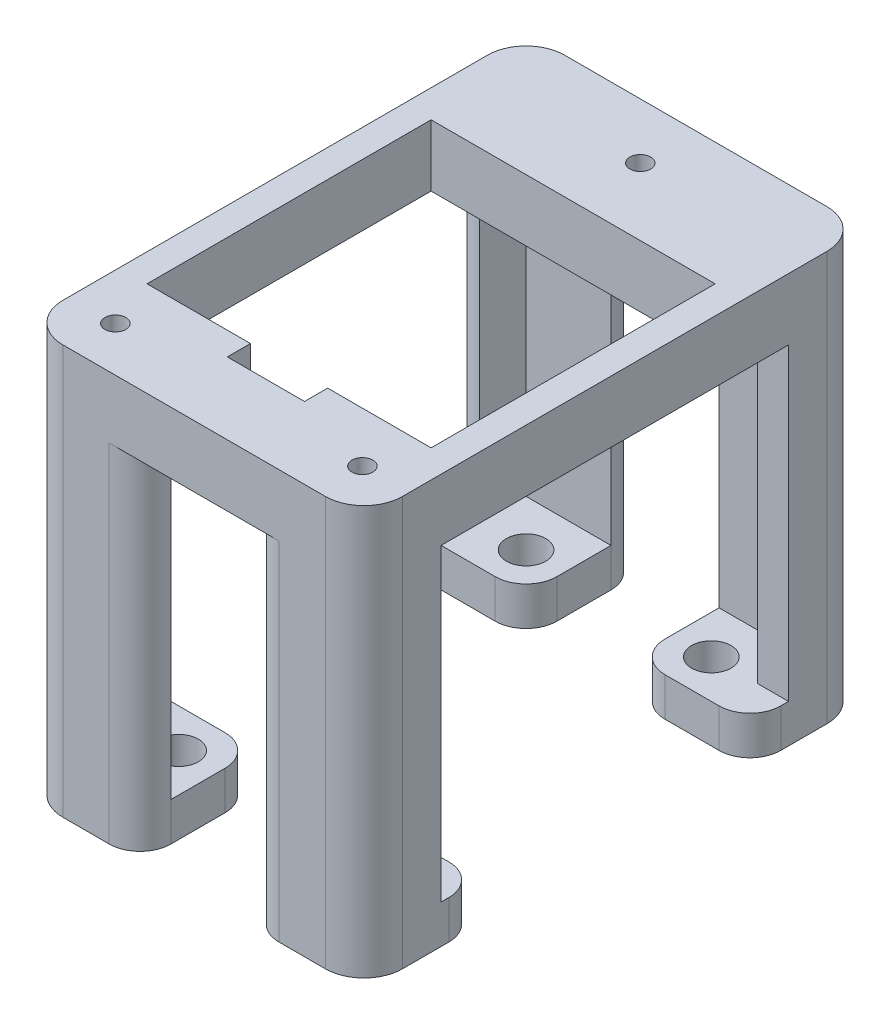
from build123d import *

# Parameters (mm, degrees)
SKETCH1_W               = 44
SKETCH1_H               = 65
BOSS_EXTRUDE1_DEPTH     = 8
CUT_EXTRUDE1_REACH      = 42.053
SKETCH2_W               = 36.8
SKETCH2_H               = 36.8
CUT_EXTRUDE2_REACH      = 42.053
SKETCH3_R               = 1.35
BOSS_EXTRUDE2_DEPTH     = 40
SKETCH6_W               = 15
SKETCH6_H               = 15
BOSS_EXTRUDE3_DEPTH     = 5
CUT_EXTRUDE3_REACH      = 64.002
SKETCH7_R               = 2.55
MIRROR2_COPY_1_DEPTH    = 40
MIRROR2_COPY_2_SKETCH_W = 15
MIRROR2_COPY_2_SKETCH_H = 15
MIRROR2_COPY_2_DEPTH    = 5
MIRROR2_COPY_3_REACH    = 64.002
MIRROR2_COPY_3_SKETCH_R = 2.55
CUT_EXTRUDE4_REACH      = 67.949
SKETCH8_W               = 10
SKETCH8_H               = 3
FILLET1_R               = 4
FILLET2_R               = 5


with BuildPart() as part:
    # Sketch1 → Boss-Extrude1 (new body)
    with BuildSketch(Plane(origin=(0, 0, 0), x_dir=(1, 0, 0), z_dir=(0, 1, 0))):
        Rectangle(SKETCH1_W, SKETCH1_H)
    extrude(amount=BOSS_EXTRUDE1_DEPTH)

    # Sketch2 → Cut-Extrude1 (cut, up to next)
    with BuildSketch(Plane(origin=(0, 8, 0), x_dir=(1, 0, 0), z_dir=(0, 1, 0)), mode=Mode.PRIVATE) as cut_extrude1_sk1:
        with Locations((0, -1.8)):
            Rectangle(SKETCH2_W, SKETCH2_H)
    cut_extrude1_tool1 = extrude(cut_extrude1_sk1.sketch, amount=-CUT_EXTRUDE1_REACH, mode=Mode.PRIVATE) & part.part
    add(cut_extrude1_tool1.solids().sort_by_distance((0, 8, 1.8))[0], mode=Mode.SUBTRACT)

    # Sketch3 → Cut-Extrude2 (cut, up to next)
    with BuildSketch(Plane(origin=(0, 8, 0), x_dir=(1, 0, 0), z_dir=(0, 1, 0)), mode=Mode.PRIVATE) as cut_extrude2_sk1:
        with Locations(Location((-16, -26.7, 0), (0, 0, 270))):
            Circle(SKETCH3_R)
    cut_extrude2_tool1 = extrude(cut_extrude2_sk1.sketch, amount=-CUT_EXTRUDE2_REACH, mode=Mode.PRIVATE) & part.part
    # Sketch3 → Cut-Extrude2 (cut, up to next)
    with BuildSketch(Plane(origin=(0, 8, 0), x_dir=(1, 0, 0), z_dir=(0, 1, 0)), mode=Mode.PRIVATE) as cut_extrude2_sk2:
        with Locations(Location((16, -26.7, 0), (0, 0, 270))):
            Circle(SKETCH3_R)
    cut_extrude2_tool2 = extrude(cut_extrude2_sk2.sketch, amount=-CUT_EXTRUDE2_REACH, mode=Mode.PRIVATE) & part.part
    # Sketch3 → Cut-Extrude2 (cut, up to next)
    with BuildSketch(Plane(origin=(0, 8, 0), x_dir=(1, 0, 0), z_dir=(0, 1, 0)), mode=Mode.PRIVATE) as cut_extrude2_sk3:
        with Locations(Location((0, 25.3, 0), (0, 0, 270))):
            Circle(SKETCH3_R)
    cut_extrude2_tool3 = extrude(cut_extrude2_sk3.sketch, amount=-CUT_EXTRUDE2_REACH, mode=Mode.PRIVATE) & part.part
    add(cut_extrude2_tool1.solids().sort_by_distance((-16, 8, 26.7))[0], mode=Mode.SUBTRACT)
    add(cut_extrude2_tool2.solids().sort_by_distance((16, 8, 26.7))[0], mode=Mode.SUBTRACT)
    add(cut_extrude2_tool3.solids().sort_by_distance((0, 8, -25.3))[0], mode=Mode.SUBTRACT)

    # Sketch5 → Boss-Extrude2 (add)
    with BuildSketch(Plane.XZ):
        Polygon((22, 32.5), (7, 32.5), (7, 28.5), (18, 28.5), (18, 22.5), (22, 22.5), align=None)
    boss_extrude2 = extrude(amount=BOSS_EXTRUDE2_DEPTH)

    # Sketch6 → Boss-Extrude3 (add)
    with BuildSketch(Plane.XZ.offset(40)):
        with Locations((14.5, 25)):
            Rectangle(SKETCH6_W, SKETCH6_H)
    boss_extrude3 = extrude(amount=BOSS_EXTRUDE3_DEPTH)

    # Sketch7 → Cut-Extrude3 (cut, up to next)
    with BuildSketch(Plane(origin=(0, -40, 0), x_dir=(1, 0, 0), z_dir=(0, 1, 0)), mode=Mode.PRIVATE) as cut_extrude3_sk1:
        with Locations(Location((12, -22.5, 0), (0, 0, 270))):
            Circle(SKETCH7_R)
    cut_extrude3_tool1 = extrude(cut_extrude3_sk1.sketch, amount=-CUT_EXTRUDE3_REACH, mode=Mode.PRIVATE) & part.part
    cut_extrude3 = cut_extrude3_tool1.solids().sort_by_distance((12, -40, 22.5))[0]
    add(cut_extrude3, mode=Mode.SUBTRACT)

    # Mirror1: Boss-Extrude2, Boss-Extrude3, Cut-Extrude3 across plane
    add(boss_extrude2.mirror(Plane(origin=(0, 0, 0), x_dir=(0, 0, 1), z_dir=(1, 0, 0))))
    add(boss_extrude3.mirror(Plane(origin=(0, 0, 0), x_dir=(0, 0, 1), z_dir=(1, 0, 0))))
    add(cut_extrude3.mirror(Plane(origin=(0, 0, 0), x_dir=(0, 0, 1), z_dir=(1, 0, 0))), mode=Mode.SUBTRACT)

    # Mirror2: Boss-Extrude2, Boss-Extrude3, Cut-Extrude3 across plane
    add(boss_extrude2.mirror(Plane.XY))
    add(boss_extrude3.mirror(Plane.XY))
    add(cut_extrude3.mirror(Plane.XY), mode=Mode.SUBTRACT)

    # Mirror2 copy 1 sketch → Mirror2 copy 1 (add)
    with BuildSketch(Plane(origin=(0, 0, 0), x_dir=(-1, 0, 0), z_dir=(0, -1, 0))):
        Polygon((22, 32.5), (7, 32.5), (7, 28.5), (18, 28.5), (18, 22.5), (22, 22.5), align=None)
    extrude(amount=MIRROR2_COPY_1_DEPTH)

    # Mirror2 copy 2 sketch → Mirror2 copy 2 (add)
    with BuildSketch(Plane(origin=(0, -40, 0), x_dir=(-1, 0, 0), z_dir=(0, -1, 0))):
        with Locations((14.5, 25)):
            Rectangle(MIRROR2_COPY_2_SKETCH_W, MIRROR2_COPY_2_SKETCH_H)
    extrude(amount=MIRROR2_COPY_2_DEPTH)

    # Mirror2 copy 3 sketch → Mirror2 copy 3 (cut, up to next)
    with BuildSketch(Plane(origin=(0, -40, 0), x_dir=(-1, 0, 0), z_dir=(0, 1, 0)), mode=Mode.PRIVATE) as mirror2_copy_3_sk1:
        with Locations(Location((12, -22.5, 0), (0, 0, 270))):
            Circle(MIRROR2_COPY_3_SKETCH_R)
    mirror2_copy_3_tool1 = extrude(mirror2_copy_3_sk1.sketch, amount=-MIRROR2_COPY_3_REACH, mode=Mode.PRIVATE) & part.part
    add(mirror2_copy_3_tool1.solids().sort_by_distance((-12, -40, -22.5))[0], mode=Mode.SUBTRACT)

    # Sketch8 → Cut-Extrude4 (cut, up to next)
    with BuildSketch(Plane(origin=(0, 8, 0), x_dir=(1, 0, 0), z_dir=(0, 1, 0)), mode=Mode.PRIVATE) as cut_extrude4_sk1:
        with Locations((0, -21.7)):
            Rectangle(SKETCH8_W, SKETCH8_H)
    cut_extrude4_tool1 = extrude(cut_extrude4_sk1.sketch, amount=-CUT_EXTRUDE4_REACH, mode=Mode.PRIVATE) & part.part
    add(cut_extrude4_tool1.solids().sort_by_distance((0, 8, 21.7))[0], mode=Mode.SUBTRACT)

    # Fillet1
    fillet1_edges = [part.edges().sort_by_distance(p)[0] for p in [
        (7, -22.5, -32.5),
        (22, -42.5, -17.5),
        (7, -42.5, -17.5),
        (-22, -20, -22.5),
        (-7, -22.5, -32.5),
        (-22, -42.5, -17.5),
        (-7, -42.5, -17.5),
        (7, -22.5, 32.5),
        (22, -42.5, 17.5),
        (7, -42.5, 17.5),
        (-7, -22.5, 32.5),
        (-22, -42.5, 17.5),
        (-7, -42.5, 17.5),
    ]]
    fillet(fillet1_edges, radius=FILLET1_R - 0.0001)  # a hair under: the kernel refuses the full size

    # Fillet2
    fillet2_edges = [part.edges().sort_by_distance(p)[0] for p in [
        (-22, -18.5, -32.5),
        (22, -18.5, -32.5),
        (22, -18.5, 32.5),
        (-22, -18.5, 32.5),
    ]]
    fillet(fillet2_edges, radius=FILLET2_R)


solid = part.part
